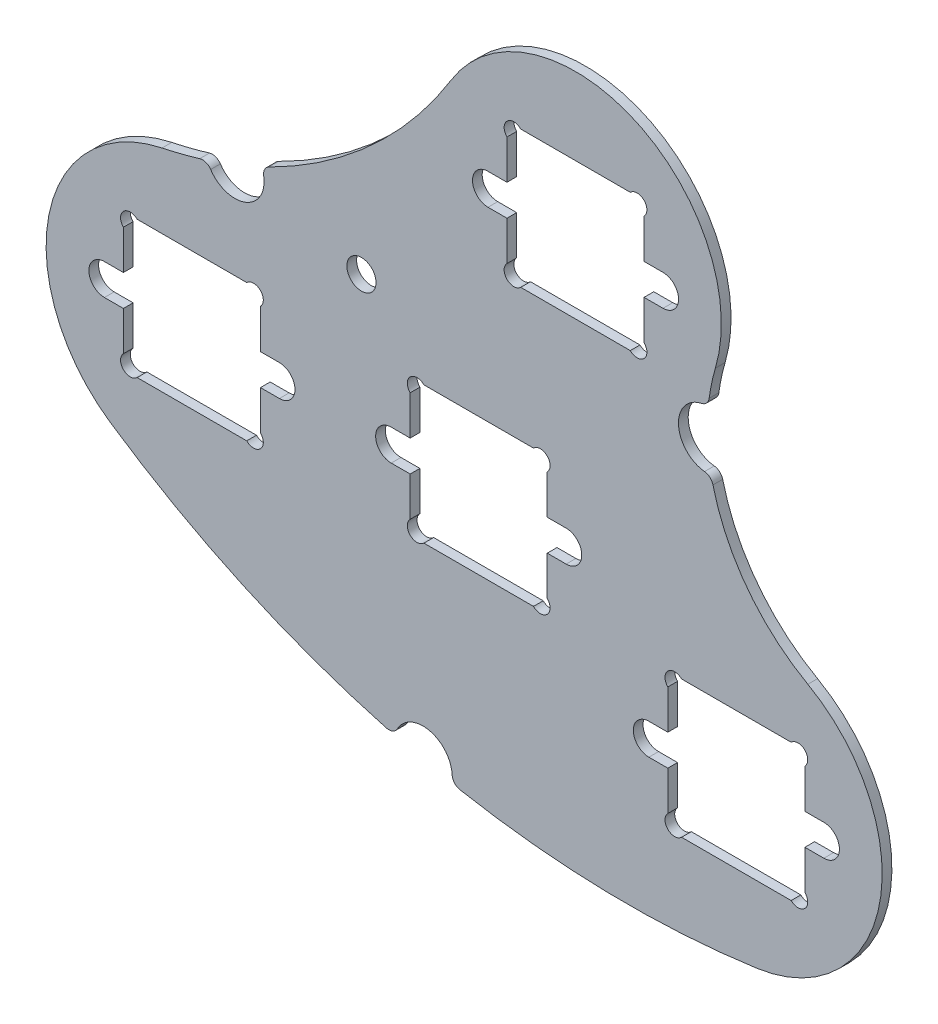
from build123d import *
from build123d.topology import SkipClean

# Parameters (mm, degrees)
BOSS_EXTRUDE1_DEPTH   = 1
SKETCH8_3_R           = 3
CUT_EXTRUDE1_DEPTH    = 182.285837692
SKETCH16_R            = 1.6
SKETCH16_W            = 18
SKETCH16_H            = 3.2
CUT_EXTRUDE2_DEPTH    = 182.285837692
CUT_EXTRUDE3_DEPTH    = 182.285837692
SKETCH9_W             = 14.1
SKETCH9_H             = 14.1
CUT_EXTRUDE4_DEPTH    = 182.285837692
F_3_0MM_DOWEL_HOLE1_D = 3
FILLET1_R             = 1


with BuildPart() as part:
    # Sketch8 → Boss-Extrude1 (new body)
    with BuildSketch(Plane.XY):
        with BuildLine():
            ThreePointArc((73.852303576, 63.794594289), (73.863549821, 63.839319131), (73.875482243, 63.883865813))
            ThreePointArc((73.875482243, 63.883865813), (76.767270103, 63.085390407), (79.729789892, 62.612657392))
            ThreePointArc((79.729789892, 62.612657392), (79.717062502, 62.538833177), (79.702495752, 62.465349771))
            ThreePointArc((79.702495752, 62.465349771), (95.373691885, 60.7573177), (111.111302129, 61.669121188))
            ThreePointArc((111.111302129, 61.669121188), (123.74416397, 73.75113123), (116.356165737, 89.593531525))
            ThreePointArc((116.356165737, 89.593531525), (107.510169126, 99.635128091), (106.844308874, 113.000828513))
            ThreePointArc((106.844308874, 113.000828513), (98.551785503, 130.943955248), (79.67265081, 125.087333856))
            ThreePointArc((79.67265081, 125.087333856), (66.957923375, 111.551078569), (49.923987164, 104.152462611))
            ThreePointArc((49.923987164, 104.152462611), (38.279791522, 92.371702096), (44.581782069, 77.053134095))
            ThreePointArc((44.581782069, 77.053134095), (58.651333394, 69.17496271), (73.852303576, 63.794594289))
        make_face()
        with BuildLine():
            ThreePointArc((56.72077423, 104.000844147), (56.721683918, 104.00117089), (56.7225936, 104.001497652))
            ThreePointArc((56.7225936, 104.001497652), (56.755397532, 103.992206145), (56.788325126, 103.983362865))
            ThreePointArc((56.788325126, 103.983362865), (56.754559843, 103.992142785), (56.72077423, 104.000844147))
        make_face(mode=Mode.SUBTRACT)
        with BuildLine():
            ThreePointArc((109.376341775, 92.015545509), (109.37615287, 92.017539878), (109.375963817, 92.019534234))
            ThreePointArc((109.375963817, 92.019534234), (109.377797318, 92.017499849), (109.379631064, 92.015465685))
            ThreePointArc((109.379631064, 92.015465685), (109.377986421, 92.015505684), (109.376341775, 92.015545509))
        make_face(mode=Mode.SUBTRACT)
        with BuildLine():
            ThreePointArc((103.532400156, 106.396636288), (103.543227812, 106.407709628), (103.554044399, 106.418793781))
            ThreePointArc((103.554044399, 106.418793781), (103.552293137, 106.396310438), (103.550744757, 106.373812212))
            ThreePointArc((103.550744757, 106.373812212), (103.541575551, 106.385226737), (103.532400156, 106.396636288))
        make_face(mode=Mode.SUBTRACT)
        with BuildLine():
            ThreePointArc((104.021801646, 107.681154775), (104.021865069, 107.684582448), (104.021929019, 107.688010111))
            ThreePointArc((104.021929019, 107.688010111), (104.063142491, 107.7381429), (104.104138674, 107.788453533))
            ThreePointArc((104.104138674, 107.788453533), (104.062244422, 107.735361058), (104.021801646, 107.681154775))
        make_face(mode=Mode.SUBTRACT)
    extrude(amount=BOSS_EXTRUDE1_DEPTH)

    # Sketch8<3> → Cut-Extrude1 (cut, through all)
    with SkipClean():  # the faces are left unmerged after this step: merging them gives an invalid solid
        with BuildSketch(Plane.XY):
            with Locations((106.04559389, 106.21341333)):
                Circle(SKETCH8_3_R)
            with Locations((76.767270103, 63.085390407)):
                Circle(SKETCH8_3_R)
            with Locations((57.420286528, 106.402169345)):
                Circle(SKETCH8_3_R)
        extrude(amount=CUT_EXTRUDE1_DEPTH, mode=Mode.SUBTRACT)

    # Sketch16 → Cut-Extrude2 (cut, through all)
    with SkipClean():  # the faces are left unmerged after this step: merging them gives an invalid solid
        with BuildSketch(Plane.XY):
            with Locations((43.996556322, 89.470524089)):
                Circle(SKETCH16_R)
            with Locations((61.996556322, 89.470524089)):
                Circle(SKETCH16_R)
            with Locations((73.496556322, 89.470524089)):
                Circle(SKETCH16_R)
            with Locations((91.496556322, 89.470524089)):
                Circle(SKETCH16_R)
            with Locations((100.001946024, 76.520067852)):
                Circle(SKETCH16_R)
            with Locations((118.001946024, 76.520067852)):
                Circle(SKETCH16_R)
            with Locations((83.45540719, 117.238694526)):
                Circle(SKETCH16_R)
            with Locations((101.45540719, 117.238694526)):
                Circle(SKETCH16_R)
            with Locations((52.996556322, 89.470524089)):
                Rectangle(SKETCH16_W, SKETCH16_H)
            with Locations((82.496556322, 89.470524089)):
                Rectangle(SKETCH16_W, SKETCH16_H)
            with Locations((109.001946024, 76.520067852)):
                Rectangle(SKETCH16_W, SKETCH16_H)
            with Locations((92.45540719, 117.238694526)):
                Rectangle(SKETCH16_W, SKETCH16_H)
        extrude(amount=CUT_EXTRUDE2_DEPTH, mode=Mode.SUBTRACT)

    # Sketch14 → Cut-Extrude3 (cut, through all)
    with SkipClean():  # the faces are left unmerged after this step: merging them gives an invalid solid
        with BuildSketch(Plane.XY):
            with BuildLine():
                Line((45.946556322, 95.106310527), (47.360769884, 96.520524089))
                ThreePointArc((47.360769884, 96.520524089), (45.946556322, 96.520524089), (45.946556322, 95.106310527))
            make_face()
            with BuildLine():
                Line((45.946556322, 83.834737652), (47.360769884, 82.420524089))
                ThreePointArc((47.360769884, 82.420524089), (45.946556322, 82.420524089), (45.946556322, 83.834737652))
            make_face()
            with BuildLine():
                Line((58.63234276, 82.420524089), (60.046556322, 83.834737652))
                ThreePointArc((60.046556322, 83.834737652), (60.046556322, 82.420524089), (58.63234276, 82.420524089))
            make_face()
            with BuildLine():
                Line((58.63234276, 96.520524089), (60.046556322, 95.106310527))
                ThreePointArc((60.046556322, 95.106310527), (60.046556322, 96.520524089), (58.63234276, 96.520524089))
            make_face()
            with BuildLine():
                Line((85.40540719, 111.602908088), (86.819620752, 110.188694526))
                ThreePointArc((86.819620752, 110.188694526), (85.40540719, 110.188694526), (85.40540719, 111.602908088))
            make_face()
            with BuildLine():
                Line((98.091193628, 110.188694526), (99.50540719, 111.602908088))
                ThreePointArc((99.50540719, 111.602908088), (99.50540719, 110.188694526), (98.091193628, 110.188694526))
            make_face()
            with BuildLine():
                Line((98.091193628, 124.288694526), (99.50540719, 122.874480963))
                ThreePointArc((99.50540719, 122.874480963), (99.50540719, 124.288694526), (98.091193628, 124.288694526))
            make_face()
            with BuildLine():
                Line((85.40540719, 122.874480963), (86.819620752, 124.288694526))
                ThreePointArc((86.819620752, 124.288694526), (85.40540719, 124.288694526), (85.40540719, 122.874480963))
            make_face()
            with BuildLine():
                Line((101.951946024, 82.155854289), (103.366159586, 83.570067852))
                ThreePointArc((103.366159586, 83.570067852), (101.951946024, 83.570067852), (101.951946024, 82.155854289))
            make_face()
            with BuildLine():
                Line((101.951946024, 70.884281414), (103.366159586, 69.470067852))
                ThreePointArc((103.366159586, 69.470067852), (101.951946024, 69.470067852), (101.951946024, 70.884281414))
            make_face()
            with BuildLine():
                Line((114.637732461, 69.470067852), (116.051946024, 70.884281414))
                ThreePointArc((116.051946024, 70.884281414), (116.051946024, 69.470067852), (114.637732461, 69.470067852))
            make_face()
            with BuildLine():
                Line((116.051946024, 82.155854289), (114.637732461, 83.570067852))
                ThreePointArc((114.637732461, 83.570067852), (116.051946024, 83.570067852), (116.051946024, 82.155854289))
            make_face()
            with BuildLine():
                Line((76.860769884, 96.520524089), (75.446556322, 95.106310527))
                ThreePointArc((75.446556322, 95.106310527), (75.446556322, 96.520524089), (76.860769884, 96.520524089))
            make_face()
            with BuildLine():
                Line((88.13234276, 96.520524089), (89.546556322, 95.106310527))
                ThreePointArc((89.546556322, 95.106310527), (89.546556322, 96.520524089), (88.13234276, 96.520524089))
            make_face()
            with BuildLine():
                Line((89.546556322, 83.834737652), (88.13234276, 82.420524089))
                ThreePointArc((88.13234276, 82.420524089), (89.546556322, 82.420524089), (89.546556322, 83.834737652))
            make_face()
            with BuildLine():
                Line((75.446556322, 83.834737652), (76.860769884, 82.420524089))
                ThreePointArc((76.860769884, 82.420524089), (75.446556322, 82.420524089), (75.446556322, 83.834737652))
            make_face()
        extrude(amount=CUT_EXTRUDE3_DEPTH, mode=Mode.SUBTRACT)

    # Sketch9 → Cut-Extrude4 (cut, through all)
    with SkipClean():  # the faces are left unmerged after this step: merging them gives an invalid solid
        with BuildSketch(Plane.XY):
            with Locations((52.996556322, 89.470524089)):
                Rectangle(SKETCH9_W, SKETCH9_H)
            with Locations((82.496556322, 89.470524089)):
                Rectangle(SKETCH9_W, SKETCH9_H)
            with Locations((109.001946024, 76.520067852)):
                Rectangle(SKETCH9_W, SKETCH9_H)
            with Locations((92.45540719, 117.238694526)):
                Rectangle(SKETCH9_W, SKETCH9_H)
        extrude(amount=CUT_EXTRUDE4_DEPTH, mode=Mode.SUBTRACT)

    # Ø3.0mm Dowel Hole1 (through all)
    with Locations(Plane.XY.offset(1)):
        with Locations((70.435309654, 103.157249982)):
            Hole(F_3_0MM_DOWEL_HOLE1_D / 2)

    # Fillet1
    fillet1_edges = [part.edges().sort_by_distance(p)[0] for p in [
        (79.702495752, 62.465349771, 0.5),
        (73.852303576, 63.794594289, 0.5),
        (106.42311517, 103.237261841, 0.5),
        (106.111211206, 109.212695638, 0.5),
        (54.596217873, 105.389926178, 0.5),
        (60.17229201, 107.596516793, 0.5),
    ]]
    fillet(fillet1_edges, radius=FILLET1_R)


solid = part.part
